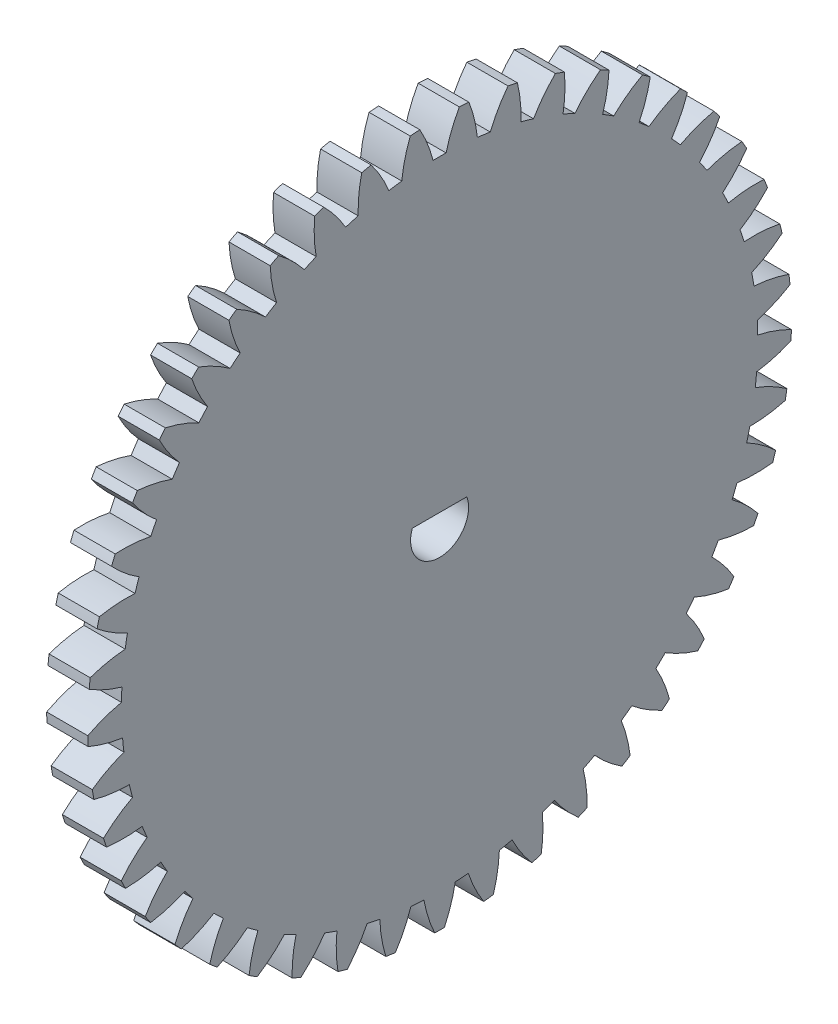
from build123d import *

# Parameters (mm, degrees)
BASPROSKE_W           = 5.5
BASPROSKE_H           = 47
TOOTHCUT_DEPTH        = 67.695202226
TEETHCUTS_COUNT       = 45
TEETHCUTS_ANGLE       = 352
BORSKE_R              = 0.4
BORE_DEPTH            = 50.0000508
CORTAR_EXTRUIR1_DEPTH = 6


with BuildPart() as part:
    # BasProSke → Base-Revolve (revolve)
    with BuildSketch(Plane(origin=(0, 0, 0), x_dir=(1, 0, 0), z_dir=(0, 1, 0))):
        with Locations((2.75, 23.5)):
            Rectangle(BASPROSKE_W, BASPROSKE_H)
    revolve(axis=Axis((-10, 0, 0), (1, 0, 0)))

    # TooCutSke → ToothCut (cut, through all)
    with BuildSketch(Plane(origin=(0, 0, 0), x_dir=(0, 0, -1), z_dir=(1, 0, 0))):
        with BuildLine():
            ThreePointArc((0.870558136, 42.49008272), (0, 42.499), (-0.870558136, 42.49008272))
            ThreePointArc((-0.870558136, 42.49008272), (-1.611306544, 44.779997814), (-2.650928503, 46.950621117))
            ThreePointArc((-2.650928503, 46.950621117), (0, 47.0254), (2.650928503, 46.950621117))
            ThreePointArc((2.650928503, 46.950621117), (1.611306544, 44.779997814), (0.870558136, 42.49008272))
        make_face()
    toothcut = extrude(amount=TOOTHCUT_DEPTH, mode=Mode.SUBTRACT)

    # TeethCuts: ToothCut ×45 about axis
    teethcuts_axis = Axis((-10, 0, 0), (1, 0, 0))
    for i in range(1, TEETHCUTS_COUNT):
        add(toothcut.rotate(teethcuts_axis, i * TEETHCUTS_ANGLE / (TEETHCUTS_COUNT - 1)), mode=Mode.SUBTRACT)

    # BorSke → Bore (cut, symmetric)
    with BuildSketch(Plane(origin=(0, 0, 0), x_dir=(0, 0, -1), z_dir=(1, 0, 0))):
        Circle(BORSKE_R)
    extrude(amount=BORE_DEPTH, both=True, mode=Mode.SUBTRACT)

    # Croquis1 → Cortar-Extruir1 (cut)
    with BuildSketch(Plane(origin=(5.5, 0, 0), x_dir=(0, 0, -1), z_dir=(1, 0, 0))):
        with BuildLine():
            Line((0, 1.325), (3.641428291, 1.325))
            ThreePointArc((3.641428291, 1.325), (0, -3.875), (-3.641428291, 1.325))
            Line((-3.641428291, 1.325), (0, 1.325))
        make_face()
    extrude(amount=-CORTAR_EXTRUIR1_DEPTH, mode=Mode.SUBTRACT)


solid = part.part
